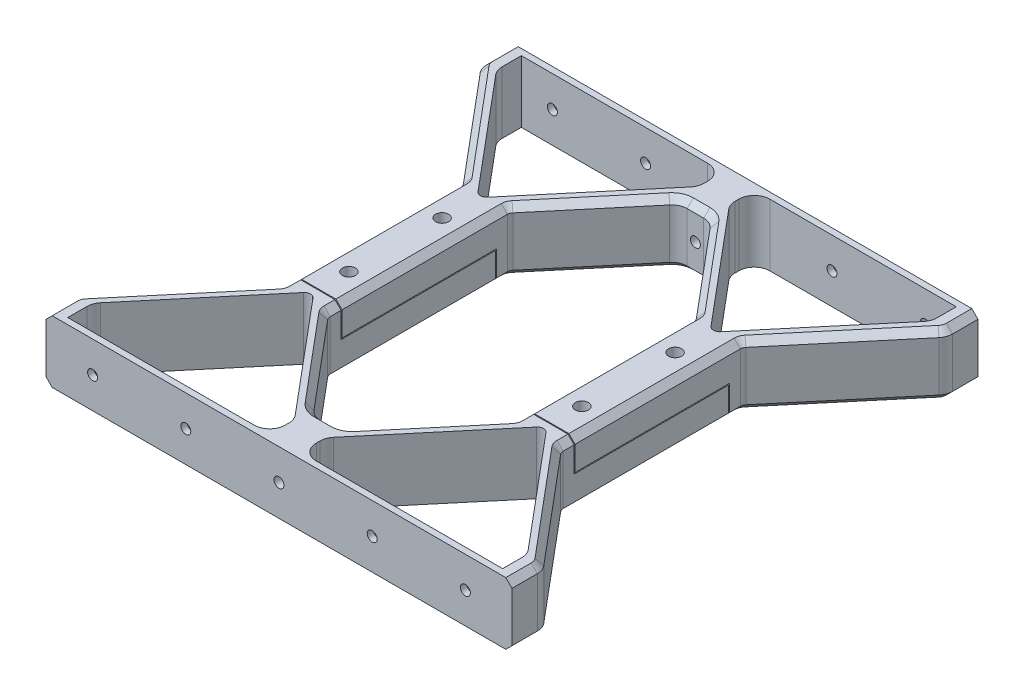
from build123d import *

# Parameters (mm, degrees)
SKETCH1_R               = 2.1
BOSS_EXTRUDE1_DEPTH     = 10
FILLET1_R               = 2
FILLET2_R               = 5
CUT_EXTRUDE1_REACH      = 183.536
CUT_EXTRUDE1_START      = 75
SKETCH3_R               = 1.6
CHAMFER1_SIZE           = 2
CUT_EXTRUDE2_DEPTH      = 107.536378763
CUT_EXTRUDE2_DEPTH_BACK = 107.536378763


with BuildPart() as part:
    # Sketch1 → Boss-Extrude1 (new, symmetric)
    with BuildSketch(Plane(origin=(0, 0, 0), x_dir=(1, 0, 0), z_dir=(0, 1, 0))):
        Polygon((0, -75), (75, -75), (75, -65), (45, -29.247392222), (45, 0), (30, 0), (30, -29.247392222), (5, -59.041232037), (0, -59.041232037), align=None)
        with Locations((37.5, -15)):
            Circle(SKETCH1_R, mode=Mode.SUBTRACT)
        Polygon((70, -65), (37.5, -26.268008241), (5, -65), (5, -73), (70, -73), align=None, mode=Mode.SUBTRACT)
    extrude(amount=BOSS_EXTRUDE1_DEPTH, both=True)

    # Fillet1
    fillet1_edges = [part.edges().sort_by_distance(p)[0] for p in [
        (30, 0, 29.247392222),
        (45, 0, 29.247392222),
        (37.5, 0, 26.268008241),
    ]]
    fillet(fillet1_edges, radius=FILLET1_R)

    # Fillet2
    fillet2_edges = [part.edges().sort_by_distance(p)[0] for p in [
        (5, 0, 73),
        (75, 0, 65),
        (70, 0, 65),
        (5, 0, 59.041232037),
        (5, 0, 65),
    ]]
    fillet(fillet2_edges, radius=FILLET2_R)

    # Mirror1: part across plane


with BuildPart() as part_1:
    add(part.part)
    add(part.part.mirror(Plane(origin=(0, 0, 0), x_dir=(0, 0, 1), z_dir=(1, 0, 0))))

    # Sketch3 → Cut-Extrude1 (cut, up to next)
    with BuildSketch(Plane.XY.offset(CUT_EXTRUDE1_START), mode=Mode.PRIVATE) as cut_extrude1_sk1:
        Circle(SKETCH3_R)
    cut_extrude1_tool1 = extrude(cut_extrude1_sk1.sketch, amount=-CUT_EXTRUDE1_REACH, mode=Mode.PRIVATE) & part_1.part
    # Sketch3 → Cut-Extrude1 (cut, up to next)
    with BuildSketch(Plane.XY.offset(CUT_EXTRUDE1_START), mode=Mode.PRIVATE) as cut_extrude1_sk2:
        with Locations((30, 0)):
            Circle(SKETCH3_R)
    cut_extrude1_tool2 = extrude(cut_extrude1_sk2.sketch, amount=-CUT_EXTRUDE1_REACH, mode=Mode.PRIVATE) & part_1.part
    # Sketch3 → Cut-Extrude1 (cut, up to next)
    with BuildSketch(Plane.XY.offset(CUT_EXTRUDE1_START), mode=Mode.PRIVATE) as cut_extrude1_sk3:
        with Locations((60, 0)):
            Circle(SKETCH3_R)
    cut_extrude1_tool3 = extrude(cut_extrude1_sk3.sketch, amount=-CUT_EXTRUDE1_REACH, mode=Mode.PRIVATE) & part_1.part
    # Sketch3 → Cut-Extrude1 (cut, up to next)
    with BuildSketch(Plane.XY.offset(CUT_EXTRUDE1_START), mode=Mode.PRIVATE) as cut_extrude1_sk4:
        with Locations((-30, 0)):
            Circle(SKETCH3_R)
    cut_extrude1_tool4 = extrude(cut_extrude1_sk4.sketch, amount=-CUT_EXTRUDE1_REACH, mode=Mode.PRIVATE) & part_1.part
    # Sketch3 → Cut-Extrude1 (cut, up to next)
    with BuildSketch(Plane.XY.offset(CUT_EXTRUDE1_START), mode=Mode.PRIVATE) as cut_extrude1_sk5:
        with Locations((-60, 0)):
            Circle(SKETCH3_R)
    cut_extrude1_tool5 = extrude(cut_extrude1_sk5.sketch, amount=-CUT_EXTRUDE1_REACH, mode=Mode.PRIVATE) & part_1.part
    add(cut_extrude1_tool1.solids().sort_by_distance((0, 0, 75))[0], mode=Mode.SUBTRACT)
    add(cut_extrude1_tool2.solids().sort_by_distance((30, 0, 75))[0], mode=Mode.SUBTRACT)
    add(cut_extrude1_tool3.solids().sort_by_distance((60, 0, 75))[0], mode=Mode.SUBTRACT)
    add(cut_extrude1_tool4.solids().sort_by_distance((-30, 0, 75))[0], mode=Mode.SUBTRACT)
    add(cut_extrude1_tool5.solids().sort_by_distance((-60, 0, 75))[0], mode=Mode.SUBTRACT)

    # Mirror2: part across plane


with BuildPart() as part_2:
    add(part_1.part)
    add(part_1.part.mirror(Plane.XY))

    # Chamfer1
    chamfer1_edges = [part_2.edges().sort_by_distance(p)[0] for p in [
        (30, 10, 0),
        (29.879385242, 10, -29.20349204),
        (29.879385242, 10, 29.20349204),
        (18.015386406, 10, -43.530098529),
        (18.015386406, 10, 43.530098529),
        (4.781553018, 10, -58.572770972),
        (4.781553018, 10, 58.572770972),
        (0, 10, -59.041232037),
        (0, 10, 59.041232037),
        (-4.781553018, 10, -58.572770972),
        (-4.781553018, 10, 58.572770972),
        (-18.015386406, 10, -43.530098529),
        (-18.015386406, 10, 43.530098529),
        (-29.879385242, 10, -29.20349204),
        (-29.879385242, 10, 29.20349204),
        (-30, 10, 0),
        (-75, -10, 70.909925586),
        (-75, -10, -70.909925586),
        (-74.698463104, -10, 65.109750455),
        (-74.698463104, -10, -65.109750455),
        (-59.649066665, -10, 46.705470048),
        (-59.649066665, -10, -46.705470048),
        (-45.120614758, -10, 29.20349204),
        (-45.120614758, -10, -29.20349204),
        (-45, -10, 0),
        (75, -10, 70.909925586),
        (75, -10, -70.909925586),
        (74.698463104, -10, 65.109750455),
        (74.698463104, -10, -65.109750455),
        (59.649066665, -10, 46.705470048),
        (59.649066665, -10, -46.705470048),
        (45.120614758, -10, 29.20349204),
        (45.120614758, -10, -29.20349204),
        (45, -10, 0),
        (-30, -10, 0),
        (-29.879385242, -10, -29.20349204),
        (-29.879385242, -10, 29.20349204),
        (-18.015386406, -10, -43.530098529),
        (-18.015386406, -10, 43.530098529),
        (-4.781553018, -10, -58.572770972),
        (-4.781553018, -10, 58.572770972),
        (0, -10, -59.041232037),
        (0, -10, 59.041232037),
        (4.781553018, -10, -58.572770972),
        (4.781553018, -10, 58.572770972),
        (18.015386406, -10, -43.530098529),
        (18.015386406, -10, 43.530098529),
        (29.879385242, -10, -29.20349204),
        (29.879385242, -10, 29.20349204),
        (30, -10, 0),
        (75, 10, 70.909925586),
        (75, 10, -70.909925586),
        (74.698463104, 10, 65.109750455),
        (74.698463104, 10, -65.109750455),
        (59.649066665, 10, 46.705470048),
        (59.649066665, 10, -46.705470048),
        (45.120614758, 10, 29.20349204),
        (45.120614758, 10, -29.20349204),
        (45, 10, 0),
        (-75, 10, 70.909925586),
        (-75, 10, -70.909925586),
        (-74.698463104, 10, 65.109750455),
        (-74.698463104, 10, -65.109750455),
        (-59.649066665, 10, 46.705470048),
        (-59.649066665, 10, -46.705470048),
        (-45.120614758, 10, 29.20349204),
        (-45.120614758, 10, -29.20349204),
        (-45, 10, 0),
    ]]
    chamfer(chamfer1_edges, length=CHAMFER1_SIZE)

    # Sketch4 → Cut-Extrude2 (cut, two sides: drawn at the far end of the back side and taken through both)
    with BuildSketch(Plane(origin=(0, 0, 0), x_dir=(0, 0, -1), z_dir=(1, 0, 0)).offset(-CUT_EXTRUDE2_DEPTH_BACK)):
        Polygon((25, -10), (25, 0.15), (-24.7, 0.15), (-24.7, 10), (-25, 10), (-25, -0.15), (24.7, -0.15), (24.7, -10), align=None)
    extrude(amount=CUT_EXTRUDE2_DEPTH + CUT_EXTRUDE2_DEPTH_BACK, mode=Mode.SUBTRACT)


with BuildPart() as cut_extrude2_piece_1:
    # of the separate pieces the step leaves, piece 1, a body of its own (cut_extrude2_pieces)
    add(part_2.part.solids().sort_by_distance((-73, 10, -75))[0])


with BuildPart() as cut_extrude2_piece_2:
    # of the separate pieces the step leaves, piece 2, a body of its own (cut_extrude2_pieces)
    add(part_2.part.solids().sort_by_distance((6.498683925, 8, 57.255170085))[0])


solid = Compound([cut_extrude2_piece_1.part, cut_extrude2_piece_2.part])
